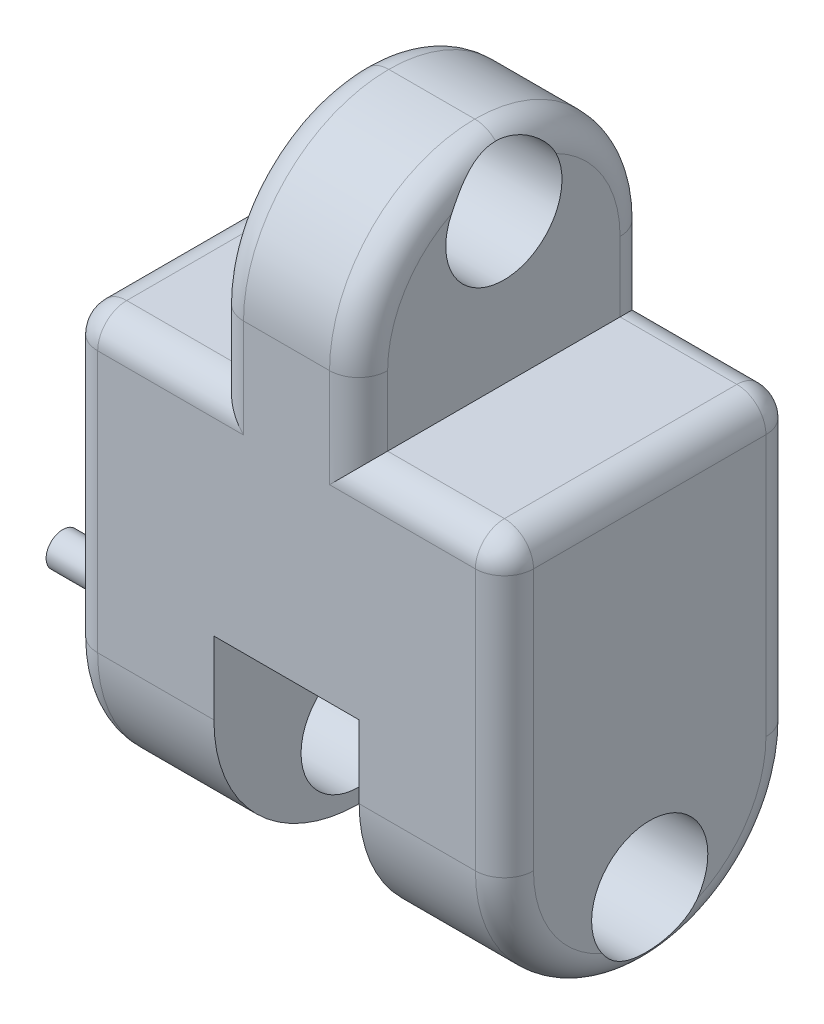
from build123d import *

# Parameters (mm, degrees)
BOSS_EXTRUDE1_DEPTH    = 100
SKETCH2_W              = 50
SKETCH2_H              = 50
CUT_EXTRUDE1_DEPTH     = 195.489074243
FILLET1_R              = 50
CUT_EXTRUDE2_DEPTH     = 25
SKETCH7_R              = 20
CUT_EXTRUDE3_DEPTH     = 234.882449106
FILLET2_R              = 50
CUT_EXTRUDE6_START     = -75
CUT_EXTRUDE6_OUTLINE_W = 50
CUT_EXTRUDE6_OUTLINE_H = 6.698729811
CUT_EXTRUDE6_DEPTH     = 50
CUT_EXTRUDE7_DEPTH     = 25
FILLET3_R              = 10
SKETCH11_W             = 50
SKETCH11_H             = 25
CUT_EXTRUDE8_DEPTH     = 99
BOSS_EXTRUDE7_DEPTH    = 0.1
FILLET4_R              = 10
FILLET5_R              = 10
SKETCH14_R             = 20
CUT_EXTRUDE9_DEPTH     = 206.380257205
SKETCH15_R             = 5.75
BOSS_EXTRUDE8_DEPTH    = 22


with BuildPart() as part:
    # Sketch1 → Boss-Extrude1 (new body)
    with BuildSketch(Plane.XY):
        Polygon((-24.8, 75), (-24.8, 149), (24.8, 149), (24.8, 75), (75, 75), (75, -75), (-75, -75), (-75, 75), align=None)
    extrude(amount=-BOSS_EXTRUDE1_DEPTH)

    # Sketch2 → Cut-Extrude1 (cut, through all)
    with BuildSketch(Plane.XY):
        with Locations((0, -75)):
            Rectangle(SKETCH2_W, SKETCH2_H)
    extrude(amount=-CUT_EXTRUDE1_DEPTH, mode=Mode.SUBTRACT)

    # Fillet1
    fillet1_edges = [part.edges().sort_by_distance(p)[0] for p in [
        (0, 149, -100),
        (0, 149, 0),
    ]]
    fillet(fillet1_edges, radius=FILLET1_R - 0.0001)  # a hair under: the kernel refuses the full size

    # Sketch6 → Cut-Extrude2 (cut, symmetric)
    with BuildSketch(Plane(origin=(0, 0, 0), x_dir=(0, 0, -1), z_dir=(1, 0, 0))):
        with BuildLine():
            Line((100, -50), (0, -50))
            ThreePointArc((0, -50), (50, 0), (100, -50))
        make_face()
    extrude(amount=CUT_EXTRUDE2_DEPTH, both=True, mode=Mode.SUBTRACT)

    # Sketch7 → Cut-Extrude3 (cut, through all)
    with BuildSketch(Plane.ZY.offset(75)):
        with Locations(Location((-50, -50, 0), (0, 0, 270))):
            Circle(SKETCH7_R)
    extrude(amount=-CUT_EXTRUDE3_DEPTH, mode=Mode.SUBTRACT)

    # Fillet2
    fillet2_edges = [part.edges().sort_by_distance(p)[0] for p in [
        (-50, -75, -100),
        (-50, -75, 0),
    ]]
    fillet(fillet2_edges, radius=FILLET2_R - 0.0001)  # a hair under: the kernel refuses the full size

    # Cut-Extrude6: read off the stored shape, not the designer's step
    # Cut-Extrude6 outline → Cut-Extrude6 (cut)
    with BuildSketch(Plane(origin=(0, 0, 0), x_dir=(1, 0, 0), z_dir=(0, 1, 0)).offset(CUT_EXTRUDE6_START)):
        with Locations((0, 96.650635095)):
            Rectangle(CUT_EXTRUDE6_OUTLINE_W, CUT_EXTRUDE6_OUTLINE_H)
        with Locations((0, 3.349364906)):
            Rectangle(CUT_EXTRUDE6_OUTLINE_W, CUT_EXTRUDE6_OUTLINE_H)
    extrude(amount=CUT_EXTRUDE6_DEPTH, mode=Mode.SUBTRACT)

    # Sketch10 → Cut-Extrude7 (cut, symmetric)
    with BuildSketch(Plane(origin=(0, 0, 0), x_dir=(0, 0, -1), z_dir=(1, 0, 0))):
        with BuildLine():
            Line((0, -25), (100, -25))
            ThreePointArc((100, -25), (50, -11.611517322), (0, -25))
        make_face()
    extrude(amount=CUT_EXTRUDE7_DEPTH, both=True, mode=Mode.SUBTRACT)

    # Fillet3
    # the kernel refuses this fillet: 10 mm, written as the material it takes off along each edge
    with BuildSketch(Plane(origin=(24.8, 99.0001, -100), x_dir=(0, 0, 1), z_dir=(0, -1, 0)), Plane(origin=(-24.8, 75, 0), x_dir=(1, 0, 0), z_dir=(0, 1, 0)), Plane(origin=(-24.8, 75, -100), x_dir=(0, 0, 1), z_dir=(0, 1, 0)), Plane(origin=(24.8, 99.0001, 0), x_dir=(-1, 0, 0), z_dir=(0, -1, 0))) as fillet3_piece_1:
        with BuildLine():
            CenterArc((FILLET3_R, FILLET3_R), FILLET3_R, 180, 90)
            Line((0, FILLET3_R), (0, 0))
            Line((0, 0), (FILLET3_R, 0))
        make_face()
    extrude(amount=24.0001, mode=Mode.SUBTRACT)
    with BuildSketch(Plane(origin=(24.8, 75, 0), x_dir=(0, -1, 0), z_dir=(1, 0, 0)), Plane(origin=(-100, 75, -100), x_dir=(0, 0, 1), z_dir=(1, 0, 0)), Plane(origin=(24.8, 75, -100), x_dir=(0, 0, 1), z_dir=(1, 0, 0)), Plane(origin=(-100, 75, 0), x_dir=(0, -1, 0), z_dir=(1, 0, 0))) as fillet3_piece_2:
        with BuildLine():
            CenterArc((FILLET3_R, FILLET3_R), FILLET3_R, 180, 90)
            Line((0, FILLET3_R), (0, 0))
            Line((0, 0), (FILLET3_R, 0))
        make_face()
    extrude(amount=75.2, mode=Mode.SUBTRACT)
    with BuildSketch(Plane(origin=(-75, -25.0001, -100), x_dir=(0, 0, 1), z_dir=(0, 1, 0)), Plane(origin=(75, 100, 0), x_dir=(-1, 0, 0), z_dir=(0, -1, 0)), Plane(origin=(75, 100, -100), x_dir=(0, 0, 1), z_dir=(0, -1, 0)), Plane(origin=(-75, -25.0001, 0), x_dir=(1, 0, 0), z_dir=(0, 1, 0))) as fillet3_piece_3:
        with BuildLine():
            CenterArc((FILLET3_R, FILLET3_R), FILLET3_R, 180, 90)
            Line((0, FILLET3_R), (0, 0))
            Line((0, 0), (FILLET3_R, 0))
        make_face()
    extrude(amount=125.0001, mode=Mode.SUBTRACT)
    with BuildSketch(Plane(origin=(-24.8, 99.0001, -49.9999), x_dir=(0, 1, 0), z_dir=(0, 0, -1))) as fillet3_piece_4:
        with BuildLine():
            CenterArc((49.9999 - FILLET3_R, FILLET3_R), FILLET3_R, 270, 90)
            Line((49.9999 - FILLET3_R, 0), (49.9999, 0))
            Line((49.9999, 0), (49.9999, FILLET3_R))
        make_face()
    revolve(axis=Axis((-24.8, 99.0001, -49.9999), (1, 0, 0)), revolution_arc=90, mode=Mode.SUBTRACT)
    with BuildSketch(Plane(origin=(-24.8, 99.0001, -50.0001), x_dir=(0, 1, 0), z_dir=(0, 0, 1))) as fillet3_piece_5:
        with BuildLine():
            CenterArc((49.9999 - FILLET3_R, -FILLET3_R), FILLET3_R, 0, 90)
            Line((49.9999, -FILLET3_R), (49.9999, 0))
            Line((49.9999, 0), (49.9999 - FILLET3_R, 0))
        make_face()
    revolve(axis=Axis((-24.8, 99.0001, -50.0001), (-1, 0, 0)), revolution_arc=90, mode=Mode.SUBTRACT)
    with BuildSketch(Plane(origin=(24.8, 99.0001, -49.9999), x_dir=(0, 1, 0), z_dir=(0, 0, -1))) as fillet3_piece_6:
        with BuildLine():
            CenterArc((49.9999 - FILLET3_R, -FILLET3_R), FILLET3_R, 0, 90)
            Line((49.9999, -FILLET3_R), (49.9999, 0))
            Line((49.9999, 0), (49.9999 - FILLET3_R, 0))
        make_face()
    revolve(axis=Axis((24.8, 99.0001, -49.9999), (1, 0, 0)), revolution_arc=90, mode=Mode.SUBTRACT)
    with BuildSketch(Plane(origin=(24.8, 99.0001, -50.0001), x_dir=(0, 1, 0), z_dir=(0, 0, 1))) as fillet3_piece_7:
        with BuildLine():
            CenterArc((49.9999 - FILLET3_R, FILLET3_R), FILLET3_R, 270, 90)
            Line((49.9999, FILLET3_R), (49.9999, 0))
            Line((49.9999, 0), (49.9999 - FILLET3_R, 0))
        make_face()
    revolve(axis=Axis((24.8, 99.0001, -50.0001), (-1, 0, 0)), revolution_arc=90, mode=Mode.SUBTRACT)
    with BuildSketch(Plane(origin=(75, -25.0001, -49.9999), x_dir=(0, 0, 1), z_dir=(0, 1, 0))) as fillet3_piece_8:
        with BuildLine():
            CenterArc((49.9999 - FILLET3_R, -FILLET3_R), FILLET3_R, 0, 90)
            Line((49.9999, -FILLET3_R), (49.9999, 0))
            Line((49.9999, 0), (49.9999 - FILLET3_R, 0))
        make_face()
    revolve(axis=Axis((75, -25.0001, -49.9999), (1, 0, 0)), revolution_arc=90, mode=Mode.SUBTRACT)
    with BuildSketch(Plane(origin=(75, -25.0001, -50.0001), x_dir=(0, 0, -1), z_dir=(0, 1, 0))) as fillet3_piece_9:
        with BuildLine():
            CenterArc((49.9999 - FILLET3_R, FILLET3_R), FILLET3_R, 270, 90)
            Line((49.9999, FILLET3_R), (49.9999, 0))
            Line((49.9999, 0), (49.9999 - FILLET3_R, 0))
        make_face()
    revolve(axis=Axis((75, -25.0001, -50.0001), (-1, 0, 0)), revolution_arc=90, mode=Mode.SUBTRACT)
    with BuildSketch(Plane(origin=(-75, -25.0001, -49.9999), x_dir=(0, 0, 1), z_dir=(0, 1, 0))) as fillet3_piece_10:
        with BuildLine():
            CenterArc((49.9999 - FILLET3_R, FILLET3_R), FILLET3_R, 270, 90)
            Line((49.9999, FILLET3_R), (49.9999, 0))
            Line((49.9999, 0), (49.9999 - FILLET3_R, 0))
        make_face()
    revolve(axis=Axis((-75, -25.0001, -49.9999), (1, 0, 0)), revolution_arc=90, mode=Mode.SUBTRACT)
    with BuildSketch(Plane(origin=(-75, -25.0001, -50.0001), x_dir=(0, 0, -1), z_dir=(0, 1, 0))) as fillet3_piece_11:
        with BuildLine():
            CenterArc((49.9999 - FILLET3_R, -FILLET3_R), FILLET3_R, 0, 90)
            Line((49.9999, -FILLET3_R), (49.9999, 0))
            Line((49.9999, 0), (49.9999 - FILLET3_R, 0))
        make_face()
    revolve(axis=Axis((-75, -25.0001, -50.0001), (-1, 0, 0)), revolution_arc=90, mode=Mode.SUBTRACT)
    with BuildSketch(Plane(origin=(-75, -75, -49.9999), x_dir=(0, 1, 0), z_dir=(0, 0, -1)), Plane(origin=(24.8, 149, -49.9999), x_dir=(0, -1, 0), z_dir=(0, 0, -1))) as fillet3_piece_12:
        with BuildLine():
            CenterArc((FILLET3_R, FILLET3_R), FILLET3_R, 180, 90)
            Line((0, FILLET3_R), (0, 0))
            Line((0, 0), (FILLET3_R, 0))
        make_face()
    extrude(amount=0.0002, mode=Mode.SUBTRACT)
    with BuildSketch(Plane(origin=(75, -75, -49.9999), x_dir=(0, 1, 0), z_dir=(0, 0, -1)), Plane(origin=(-24.8, 149, -49.9999), x_dir=(0, -1, 0), z_dir=(0, 0, -1))) as fillet3_piece_13:
        with BuildLine():
            CenterArc((FILLET3_R, -FILLET3_R), FILLET3_R, 90, 90)
            Line((0, -FILLET3_R), (0, 0))
            Line((0, 0), (FILLET3_R, 0))
        make_face()
    extrude(amount=0.0002, mode=Mode.SUBTRACT)
    with BuildSketch(Plane(origin=(-0.2, 75, -100), x_dir=(0, 0, 1), z_dir=(1, 0, 0))) as fillet3_piece_14a_section:
        with BuildLine():
            CenterArc((FILLET3_R, FILLET3_R), FILLET3_R, 180, 90)
            Line((0, FILLET3_R), (0, 0))
            Line((0, 0), (FILLET3_R, 0))
        make_face()
    fillet3_piece_14a = extrude(amount=100.2, mode=Mode.PRIVATE)
    fillet3_piece_14a = split(fillet3_piece_14a, bisect_by=Plane(origin=(24.8, 75, -100), z_dir=(-1, 0, 0)), keep=Keep.TOP, mode=Mode.PRIVATE)
    with BuildSketch(Plane(origin=(24.8, 99.0001, -100), x_dir=(0, 0, 1), z_dir=(0, -1, 0))) as fillet3_piece_14b_section:
        with BuildLine():
            CenterArc((FILLET3_R, FILLET3_R), FILLET3_R, 180, 90)
            Line((0, FILLET3_R), (0, 0))
            Line((0, 0), (FILLET3_R, 0))
        make_face()
    fillet3_piece_14b = extrude(amount=49.0001, mode=Mode.PRIVATE)
    fillet3_piece_14b = split(fillet3_piece_14b, bisect_by=Plane(origin=(24.8, 75, -100), z_dir=(0, -1, 0)), keep=Keep.TOP, mode=Mode.PRIVATE)
    fillet3_piece_14 = fillet3_piece_14a & fillet3_piece_14b
    add(fillet3_piece_14, mode=Mode.SUBTRACT)
    with BuildSketch(Plane(origin=(-0.2, 75, 0), x_dir=(0, -1, 0), z_dir=(1, 0, 0))) as fillet3_piece_15a_section:
        with BuildLine():
            CenterArc((FILLET3_R, FILLET3_R), FILLET3_R, 180, 90)
            Line((0, FILLET3_R), (0, 0))
            Line((0, 0), (FILLET3_R, 0))
        make_face()
    fillet3_piece_15a = extrude(amount=100.2, mode=Mode.PRIVATE)
    fillet3_piece_15a = split(fillet3_piece_15a, bisect_by=Plane(origin=(24.8, 75, 0), z_dir=(-1, 0, 0)), keep=Keep.TOP, mode=Mode.PRIVATE)
    with BuildSketch(Plane(origin=(24.8, 99.0001, 0), x_dir=(-1, 0, 0), z_dir=(0, -1, 0))) as fillet3_piece_15b_section:
        with BuildLine():
            CenterArc((FILLET3_R, FILLET3_R), FILLET3_R, 180, 90)
            Line((0, FILLET3_R), (0, 0))
            Line((0, 0), (FILLET3_R, 0))
        make_face()
    fillet3_piece_15b = extrude(amount=49.0001, mode=Mode.PRIVATE)
    fillet3_piece_15b = split(fillet3_piece_15b, bisect_by=Plane(origin=(24.8, 75, 0), z_dir=(0, -1, 0)), keep=Keep.TOP, mode=Mode.PRIVATE)
    fillet3_piece_15 = fillet3_piece_15a & fillet3_piece_15b
    add(fillet3_piece_15, mode=Mode.SUBTRACT)
    with BuildSketch(Plane(origin=(-24.8, 50, -100), x_dir=(0, 0, 1), z_dir=(0, 1, 0))) as fillet3_piece_16a_section:
        with BuildLine():
            CenterArc((FILLET3_R, FILLET3_R), FILLET3_R, 180, 90)
            Line((0, FILLET3_R), (0, 0))
            Line((0, 0), (FILLET3_R, 0))
        make_face()
    fillet3_piece_16a = extrude(amount=49.0001, mode=Mode.PRIVATE)
    fillet3_piece_16a = split(fillet3_piece_16a, bisect_by=Plane(origin=(-24.8, 75, -100), z_dir=(0, -1, 0)), keep=Keep.TOP, mode=Mode.PRIVATE)
    with BuildSketch(Plane(origin=(-100, 75, -100), x_dir=(0, 0, 1), z_dir=(1, 0, 0))) as fillet3_piece_16b_section:
        with BuildLine():
            CenterArc((FILLET3_R, FILLET3_R), FILLET3_R, 180, 90)
            Line((0, FILLET3_R), (0, 0))
            Line((0, 0), (FILLET3_R, 0))
        make_face()
    fillet3_piece_16b = extrude(amount=100.2, mode=Mode.PRIVATE)
    fillet3_piece_16b = split(fillet3_piece_16b, bisect_by=Plane(origin=(-24.8, 75, -100), z_dir=(1, 0, 0)), keep=Keep.TOP, mode=Mode.PRIVATE)
    fillet3_piece_16 = fillet3_piece_16a & fillet3_piece_16b
    add(fillet3_piece_16, mode=Mode.SUBTRACT)
    with BuildSketch(Plane(origin=(-24.8, 50, 0), x_dir=(1, 0, 0), z_dir=(0, 1, 0))) as fillet3_piece_17a_section:
        with BuildLine():
            CenterArc((FILLET3_R, FILLET3_R), FILLET3_R, 180, 90)
            Line((0, FILLET3_R), (0, 0))
            Line((0, 0), (FILLET3_R, 0))
        make_face()
    fillet3_piece_17a = extrude(amount=49.0001, mode=Mode.PRIVATE)
    fillet3_piece_17a = split(fillet3_piece_17a, bisect_by=Plane(origin=(-24.8, 75, 0), z_dir=(0, -1, 0)), keep=Keep.TOP, mode=Mode.PRIVATE)
    with BuildSketch(Plane(origin=(-100, 75, 0), x_dir=(0, -1, 0), z_dir=(1, 0, 0))) as fillet3_piece_17b_section:
        with BuildLine():
            CenterArc((FILLET3_R, FILLET3_R), FILLET3_R, 180, 90)
            Line((0, FILLET3_R), (0, 0))
            Line((0, 0), (FILLET3_R, 0))
        make_face()
    fillet3_piece_17b = extrude(amount=100.2, mode=Mode.PRIVATE)
    fillet3_piece_17b = split(fillet3_piece_17b, bisect_by=Plane(origin=(-24.8, 75, 0), z_dir=(1, 0, 0)), keep=Keep.TOP, mode=Mode.PRIVATE)
    fillet3_piece_17 = fillet3_piece_17a & fillet3_piece_17b
    add(fillet3_piece_17, mode=Mode.SUBTRACT)

    # Sketch11 → Cut-Extrude8 (cut)
    with BuildSketch(Plane.XY):
        with Locations((0, -12.5)):
            Rectangle(SKETCH11_W, SKETCH11_H)
    extrude(amount=-CUT_EXTRUDE8_DEPTH, mode=Mode.SUBTRACT)

    # Fillet5
    # the kernel refuses this fillet: 10 mm, written as the material it takes off along each edge
    with BuildSketch(Plane(origin=(65, 65, -10), x_dir=(0, 1, 0), z_dir=(1, 0, 0))) as fillet5_piece_1_section:
        Polygon((0, 0), (FILLET5_R, 0), (FILLET5_R, FILLET5_R), (0, FILLET5_R), align=None)
    fillet5_piece_1 = extrude(amount=FILLET5_R, mode=Mode.PRIVATE)
    fillet5_piece_1 = fillet5_piece_1 - Plane(origin=(65, 65, -10), x_dir=(0, -0.7071067811865475, -0.7071067811865475), z_dir=(1, 0, 0)) * Sphere(FILLET5_R, mode=Mode.PRIVATE)
    add(fillet5_piece_1, mode=Mode.SUBTRACT)
    with BuildSketch(Plane(origin=(65, 65, -90), x_dir=(0, 1, 0), z_dir=(1, 0, 0))) as fillet5_piece_2_section:
        Polygon((0, 0), (FILLET5_R, 0), (FILLET5_R, -FILLET5_R), (0, -FILLET5_R), align=None)
    fillet5_piece_2 = extrude(amount=FILLET5_R, mode=Mode.PRIVATE)
    fillet5_piece_2 = fillet5_piece_2 - Plane(origin=(65, 65, -90), x_dir=(0, -0.7071067811865475, 0.7071067811865475), z_dir=(1, 0, 0)) * Sphere(FILLET5_R, mode=Mode.PRIVATE)
    add(fillet5_piece_2, mode=Mode.SUBTRACT)
    with BuildSketch(Plane(origin=(-65, 65, -90), x_dir=(0, 1, 0), z_dir=(-1, 0, 0))) as fillet5_piece_3_section:
        Polygon((0, 0), (FILLET5_R, 0), (FILLET5_R, FILLET5_R), (0, FILLET5_R), align=None)
    fillet5_piece_3 = extrude(amount=FILLET5_R, mode=Mode.PRIVATE)
    fillet5_piece_3 = fillet5_piece_3 - Plane(origin=(-65, 65, -90), x_dir=(0, -0.7071067811865475, 0.7071067811865475), z_dir=(-1, 0, 0)) * Sphere(FILLET5_R, mode=Mode.PRIVATE)
    add(fillet5_piece_3, mode=Mode.SUBTRACT)
    with BuildSketch(Plane(origin=(-65, 65, -10), x_dir=(0, 1, 0), z_dir=(-1, 0, 0))) as fillet5_piece_4_section:
        Polygon((0, 0), (FILLET5_R, 0), (FILLET5_R, -FILLET5_R), (0, -FILLET5_R), align=None)
    fillet5_piece_4 = extrude(amount=FILLET5_R, mode=Mode.PRIVATE)
    fillet5_piece_4 = fillet5_piece_4 - Plane(origin=(-65, 65, -10), x_dir=(0, -0.7071067811865475, -0.7071067811865475), z_dir=(-1, 0, 0)) * Sphere(FILLET5_R, mode=Mode.PRIVATE)
    add(fillet5_piece_4, mode=Mode.SUBTRACT)
    with BuildSketch(Plane(origin=(75, 75, -10), x_dir=(0, -1, 0), z_dir=(0, 0, -1))) as fillet5_piece_5:
        with BuildLine():
            CenterArc((FILLET5_R, FILLET5_R), FILLET5_R, 180, 90)
            Line((0, FILLET5_R), (0, 0))
            Line((0, 0), (FILLET5_R, 0))
        make_face()
    extrude(amount=80, mode=Mode.SUBTRACT)
    with BuildSketch(Plane(origin=(-75, 75, -10), x_dir=(0, -1, 0), z_dir=(0, 0, -1))) as fillet5_piece_6:
        with BuildLine():
            CenterArc((FILLET5_R, -FILLET5_R), FILLET5_R, 90, 90)
            Line((0, -FILLET5_R), (0, 0))
            Line((0, 0), (FILLET5_R, 0))
        make_face()
    extrude(amount=80, mode=Mode.SUBTRACT)

    # Sketch14 → Cut-Extrude9 (cut, through all)
    with BuildSketch(Plane(origin=(24.8, 0, 0), x_dir=(0, 0, -1), z_dir=(1, 0, 0))):
        with Locations(Location((50, 126, 0), (0, 0, 25.856016698))):
            Circle(SKETCH14_R)
    extrude(amount=-CUT_EXTRUDE9_DEPTH, mode=Mode.SUBTRACT)

    # Sketch15 → Boss-Extrude8 (add)
    with BuildSketch(Plane.ZY.offset(75)):
        with Locations(Location((-20, -20, 0), (0, 0, 270))):
            Circle(SKETCH15_R)
    extrude(amount=BOSS_EXTRUDE8_DEPTH)


with BuildPart() as body_2:
    # Sketch13 → Boss-Extrude7 (new body)
    with BuildSketch(Plane(origin=(0, 0, -100), x_dir=(-1, 0, 0), z_dir=(0, 0, -1))):
        Polygon((-25, -25), (-25, -55), (25.018802851, -55), (25, -25), align=None)
    extrude(amount=BOSS_EXTRUDE7_DEPTH)

    # Fillet4
    # the kernel refuses this fillet: 10 mm, written as the material it takes off along each edge
    with BuildSketch(Plane(origin=(-25.021013242, -58.526683302, -100.1), x_dir=(0, 0, 1), z_dir=(0.0006267615930632001, 0.9999998035849335, 0))) as fillet4_piece_1:
        with BuildLine():
            CenterArc((10, 1.410673598), FILLET4_R, 180, 8.109614456)
            Line((0, 1.410673598), (0, 0))
            Line((0, 0), (0.1, 0))
        make_face()
    extrude(amount=37.053373882, mode=Mode.SUBTRACT)
    with BuildSketch(Plane(origin=(25, -21.473316005, -100.1), x_dir=(0, 0, 1), z_dir=(0, -1, 0))) as fillet4_piece_2:
        with BuildLine():
            CenterArc((10, 1.410673598), FILLET4_R, 180, 8.109614456)
            Line((0, 1.410673598), (0, 0))
            Line((0, 0), (0.1, 0))
        make_face()
    extrude(amount=37.05336799, mode=Mode.SUBTRACT)
    with BuildSketch(Plane(origin=(28.526683995, -55, -100.1), x_dir=(0, 0, 1), z_dir=(-1, 0, 0))) as fillet4_piece_3:
        with BuildLine():
            CenterArc((10, 1.410673598), FILLET4_R, 180, 8.109614456)
            Line((0, 1.410673598), (0, 0))
            Line((0, 0), (0.1, 0))
        make_face()
    extrude(amount=57.072170841, mode=Mode.SUBTRACT)


solid = Compound([part.part, body_2.part])
